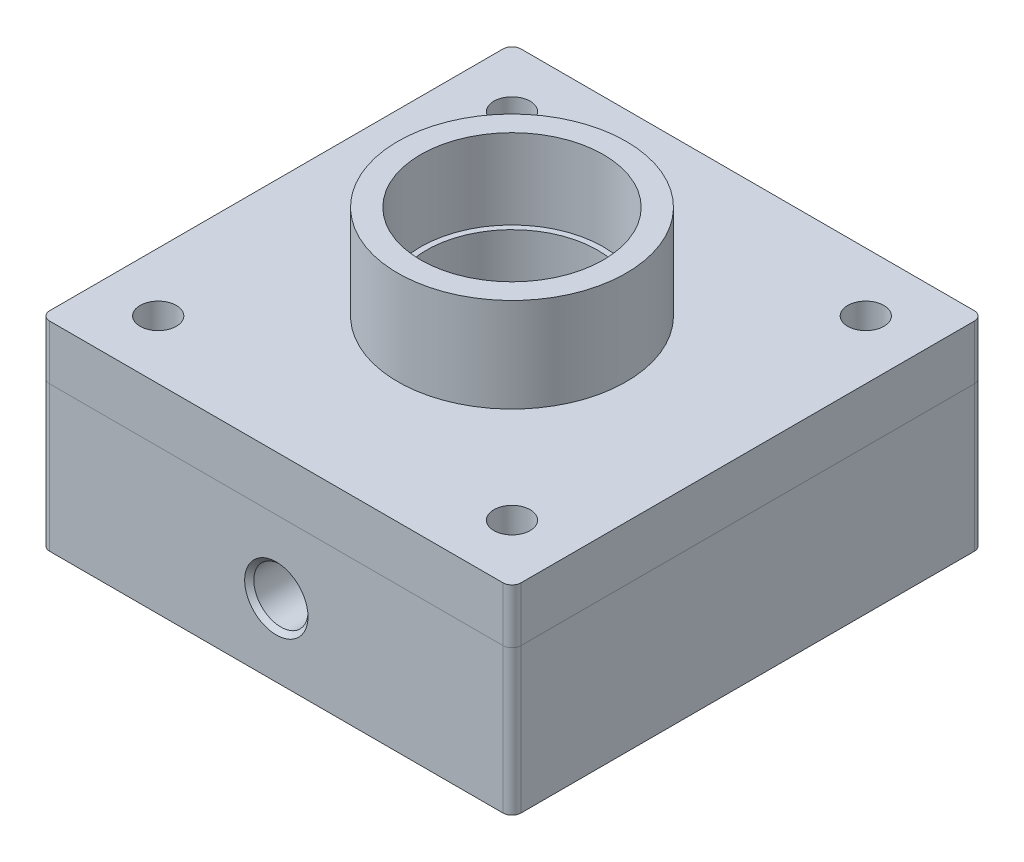
from build123d import *

# Parameters (mm, degrees)
SKETCH1_W                              = 165.1
SKETCH1_H                              = 165.1
BOSS_EXTRUDE1_DEPTH                    = 50.8
SKETCH2_R                              = 40
BOSS_EXTRUDE2_DEPTH                    = 52
SKETCH3_R                              = 32
CUT_EXTRUDE1_DEPTH                     = 28
SKETCH4_R                              = 30
CUT_EXTRUDE2_DEPTH                     = 22
FILLET1_R                              = 3.175
SKETCH5_R                              = 20
CUT_EXTRUDE3_DEPTH                     = 40
SKETCH6_R                              = 76.2
SKETCH6_R_2                            = 69.85
CUT_EXTRUDE4_DEPTH                     = 8
F_1_2_14_NPSM_TAPPED_HOLE1_D           = 18.9738
F_1_2_14_NPSM_TAPPED_HOLE1_DEPTH       = 47.24
F_1_2_14_NPSM_TAPPED_HOLE1_CSINK_D     = 22.1742
F_1_2_14_NPSM_TAPPED_HOLE1_CSINK_ANGLE = 90
F_1_2_14_NPSM_TAPPED_HOLE1_TIP         = 5.700304607
SKETCH10_R                             = 6.35
CUT_EXTRUDE5_DEPTH                     = 25
SKETCH11_R                             = 6.35
CUT_EXTRUDE6_DEPTH                     = 156.553350976
SKETCH12_R                             = 40
SKETCH12_R_2                           = 6.35
BOSS_EXTRUDE3_DEPTH                    = 19.05


with BuildPart() as part:
    # Sketch1 → Boss-Extrude1 (new body)
    with BuildSketch(Plane(origin=(0, 0, 0), x_dir=(1, 0, 0), z_dir=(0, 1, 0))):
        Rectangle(SKETCH1_W, SKETCH1_H)
    extrude(amount=BOSS_EXTRUDE1_DEPTH)

    # Sketch2 → Boss-Extrude2 (add)
    with BuildSketch(Plane(origin=(0, 50.8, 0), x_dir=(1, 0, 0), z_dir=(0, 1, 0))):
        Circle(SKETCH2_R)
    extrude(amount=BOSS_EXTRUDE2_DEPTH)

    # Sketch3 → Cut-Extrude1 (cut)
    with BuildSketch(Plane(origin=(0, 102.8, 0), x_dir=(1, 0, 0), z_dir=(0, 1, 0))):
        Circle(SKETCH3_R)
    extrude(amount=-CUT_EXTRUDE1_DEPTH, mode=Mode.SUBTRACT)

    # Sketch4 → Cut-Extrude2 (cut)
    with BuildSketch(Plane(origin=(0, 74.8, 0), x_dir=(1, 0, 0), z_dir=(0, 1, 0))):
        Circle(SKETCH4_R)
    extrude(amount=-CUT_EXTRUDE2_DEPTH, mode=Mode.SUBTRACT)

    # Fillet1
    fillet1_edges = [part.edges().sort_by_distance(p)[0] for p in [
        (-82.55, 25.4, 82.55),
        (-82.55, 25.4, -82.55),
        (82.55, 25.4, -82.55),
        (82.55, 25.4, 82.55),
    ]]
    fillet(fillet1_edges, radius=FILLET1_R)

    # Sketch5 → Cut-Extrude3 (cut)
    with BuildSketch(Plane.XZ):
        Circle(SKETCH5_R)
    extrude(amount=-CUT_EXTRUDE3_DEPTH, mode=Mode.SUBTRACT)

    # Sketch6 → Cut-Extrude4 (cut)
    with BuildSketch(Plane.XZ):
        Circle(SKETCH6_R)
        Circle(SKETCH6_R_2, mode=Mode.SUBTRACT)
    extrude(amount=-CUT_EXTRUDE4_DEPTH, mode=Mode.SUBTRACT)

    # 1/2-14 NPSM Tapped Hole1
    with Locations(Plane.XY.offset(82.55)):
        with Locations((0, 25.4)):
            CounterSinkHole(F_1_2_14_NPSM_TAPPED_HOLE1_D / 2, F_1_2_14_NPSM_TAPPED_HOLE1_CSINK_D / 2, depth=F_1_2_14_NPSM_TAPPED_HOLE1_DEPTH, counter_sink_angle=F_1_2_14_NPSM_TAPPED_HOLE1_CSINK_ANGLE)
            with Locations((0, 0, -(F_1_2_14_NPSM_TAPPED_HOLE1_DEPTH + F_1_2_14_NPSM_TAPPED_HOLE1_TIP / 2))):  # 118° drill point
                Cone(0, F_1_2_14_NPSM_TAPPED_HOLE1_D / 2, F_1_2_14_NPSM_TAPPED_HOLE1_TIP, mode=Mode.SUBTRACT)

    # Sketch10 → Cut-Extrude5 (cut)
    with BuildSketch(Plane.XZ):
        with Locations((0, 50.55)):
            Circle(SKETCH10_R)
    extrude(amount=-CUT_EXTRUDE5_DEPTH, mode=Mode.SUBTRACT)

    # Sketch11 → Cut-Extrude6 (cut, through all)
    with BuildSketch(Plane.XZ):
        with Locations((-61.963767235, 61.963767235)):
            Circle(SKETCH11_R)
        with Locations((61.963767235, 61.963767235)):
            Circle(SKETCH11_R)
        with Locations((61.963767235, -61.963767235)):
            Circle(SKETCH11_R)
        with Locations((-61.963767235, -61.963767235)):
            Circle(SKETCH11_R)
    extrude(amount=-CUT_EXTRUDE6_DEPTH, mode=Mode.SUBTRACT)


with BuildPart() as body_2:
    # Sketch12 → Boss-Extrude3 (new body)
    with BuildSketch(Plane(origin=(0, 50.8, 0), x_dir=(1, 0, 0), z_dir=(0, 1, 0))):
        with BuildLine():
            Line((-82.55, 79.375), (-82.55, -79.375))
            ThreePointArc((-82.55, -79.375), (-81.62006403, -81.62006403), (-79.375, -82.55))
            Line((-79.375, -82.55), (79.375, -82.55))
            ThreePointArc((79.375, -82.55), (81.62006403, -81.62006403), (82.55, -79.375))
            Line((82.55, -79.375), (82.55, 79.375))
            ThreePointArc((82.55, 79.375), (81.62006403, 81.62006403), (79.375, 82.55))
            Line((79.375, 82.55), (-79.375, 82.55))
            ThreePointArc((-79.375, 82.55), (-81.62006403, 81.62006403), (-82.55, 79.375))
        make_face()
        Circle(SKETCH12_R, mode=Mode.SUBTRACT)
        with Locations((61.963767235, -61.963767235)):
            Circle(SKETCH12_R_2, mode=Mode.SUBTRACT)
        with Locations((61.963767235, 61.963767235)):
            Circle(SKETCH12_R_2, mode=Mode.SUBTRACT)
        with Locations((-61.963767235, 61.963767235)):
            Circle(SKETCH12_R_2, mode=Mode.SUBTRACT)
        with Locations((-61.963767235, -61.963767235)):
            Circle(SKETCH12_R_2, mode=Mode.SUBTRACT)
    extrude(amount=BOSS_EXTRUDE3_DEPTH)


solid = Compound([part.part, body_2.part])
